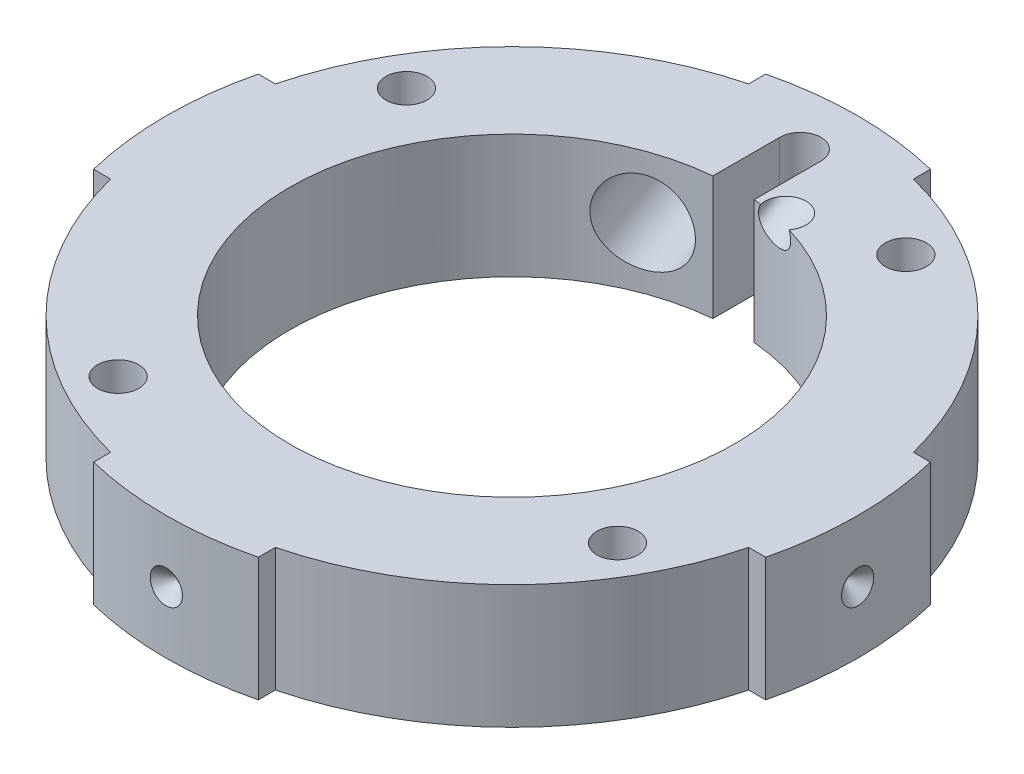
from build123d import *

# Parameters (mm, degrees)
SKETCH1_R               = 40
BOSS_EXTRUDE1_DEPTH     = 15
BOSS_EXTRUDE2_DEPTH     = 15
CIRPATTERN1_COUNT       = 4
CUT_EXTRUDE1_REACH      = 102.194
CUT_EXTRUDE1_END_RADIUS = 27
SKETCH3_R               = 5
CUT_EXTRUDE2_REACH      = 63.262
SKETCH7_R               = 2.5
CIRPATTERN2_COUNT       = 4


with BuildPart() as part:
    # Sketch1 → Boss-Extrude1 (new body)
    with BuildSketch(Plane(origin=(0, 0, 0), x_dir=(1, 0, 0), z_dir=(0, 1, 0))):
        with Locations(Location((0, 0, 0), (0, 0, 270))):
            Circle(SKETCH1_R)
        with BuildLine():
            Line((-2.5, 26.884010118), (-2.5, 35))
            ThreePointArc((-2.5, 35), (0, 37.5), (2.5, 35))
            Line((2.5, 35), (2.5, 26.884010118))
            ThreePointArc((2.5, 26.884010118), (19.956202043, 18.186533479), (27, 0))
            ThreePointArc((27, 0), (-18.186533479, -19.956202043), (-2.5, 26.884010118))
        make_face(mode=Mode.SUBTRACT)
    extrude(amount=BOSS_EXTRUDE1_DEPTH)

    # Sketch2 → Boss-Extrude2 (add)
    with BuildSketch(Plane(origin=(0, 0, 0), x_dir=(1, 0, 0), z_dir=(0, 1, 0))):
        with BuildLine():
            Line((-10, 38.729833462), (-10, 40.792156109))
            ThreePointArc((-10, 40.792156109), (0, 42), (10, 40.792156109))
            Line((10, 40.792156109), (10, 38.729833462))
            ThreePointArc((10, 38.729833462), (0, 40), (-10, 38.729833462))
        make_face()
    boss_extrude2 = extrude(amount=BOSS_EXTRUDE2_DEPTH)

    # CirPattern1: Boss-Extrude2 ×4 about axis
    cirpattern1_axis = Axis((0, 0, 0), (0, 1, 0))
    for i in range(1, CIRPATTERN1_COUNT):
        add(boss_extrude2.rotate(cirpattern1_axis, i * 360 / CIRPATTERN1_COUNT))

    # Cut-Extrude1: up to this cylinder (the profile starts outside it)
    cut_extrude1_end = Plane(origin=(0, 7.5, 0), z_dir=(0, -1, 0)) * Cylinder(CUT_EXTRUDE1_END_RADIUS, 259.388, mode=Mode.PRIVATE)
    # Sketch3 → Cut-Extrude1 (cut, up to the surface)
    with BuildSketch(Plane(origin=(-14.36484602, 0, -39.467090073), x_dir=(0, -1, 0), z_dir=(-0.34202014332566616, 0, -0.9396926207859094)), mode=Mode.PRIVATE) as cut_extrude1_sk1:
        with Locations(Location((-7.5, 0, 0), (0, 0, 90))):
            Circle(SKETCH3_R)
    cut_extrude1_tool1 = extrude(cut_extrude1_sk1.sketch, amount=-CUT_EXTRUDE1_REACH, mode=Mode.PRIVATE) - cut_extrude1_end
    add(cut_extrude1_tool1.solids().sort_by_distance((-14.364846, 7.5, -39.46709))[0], mode=Mode.SUBTRACT)

    # Cut-Loft1: read off the stored shape, not the designer's step
    # Cut-Loft1: loft between two sections, ruled curve by curve
    cut_loft1_from = [
        Edge.make_bspline([(3.514240275, 15, -26.425622361), (3.43403107, 15, -26.617896283), (3.366678926, 15, -26.845149984), (3.307378731, 15, -27.375176333), (3.316276229, 15, -27.679385236), (3.439149004, 15, -28.164052423), (3.499144635, 15, -28.33030076), (3.660731431, 15, -28.657904123), (3.762322597, 15, -28.819259148), (4.01061992, 15, -29.122797357), (4.156634299, 15, -29.264354751), (4.484735709, 15, -29.510646827), (4.666742961, 15, -29.615210684), (5.051290806, 15, -29.775629094), (5.253649364, 15, -29.831407709), (5.659510988, 15, -29.891296475), (5.862836528, 15, -29.895470114), (6.253234588, 15, -29.858370786), (6.439375692, 15, -29.817046477), (6.785871072, 15, -29.701395244), (6.946225348, 15, -29.627068321), (7.37710147, 15, -29.373403645), (7.599547955, 15, -29.165702458), (7.934492045, 15, -28.750664024), (8.048605206, 15, -28.542917202), (8.209023616, 15, -28.158369358), (8.27637576, 15, -27.931115657), (8.335675954, 15, -27.401089308), (8.326778456, 15, -27.096880405), (8.203905682, 15, -26.612213219), (8.143910051, 15, -26.445964881), (7.982323255, 15, -26.118361518), (7.880732089, 15, -25.957006493), (7.632434766, 15, -25.653468284), (7.486420387, 15, -25.51191089), (7.158318977, 15, -25.265618814), (6.976311725, 15, -25.161054957), (6.59176388, 15, -25.000636547), (6.389405322, 15, -24.944857932), (5.983543698, 15, -24.884969166), (5.780218158, 15, -24.880795527), (5.389820098, 15, -24.917894855), (5.203678994, 15, -24.959219164), (4.857183614, 15, -25.074870397), (4.696829338, 15, -25.14919732), (4.265953216, 15, -25.402861996), (4.043506731, 15, -25.610563184), (3.708562641, 15, -26.025601617), (3.59444948, 15, -26.233348439), (3.514240275, 15, -26.425622361)], [0, 0, 0, 0, 0.0625, 0.0625, 0.125, 0.125, 0.15625, 0.15625, 0.1875, 0.1875, 0.21875, 0.21875, 0.25, 0.25, 0.28125, 0.28125, 0.3125, 0.3125, 0.34375, 0.34375, 0.375, 0.375, 0.4375, 0.4375, 0.5, 0.5, 0.5625, 0.5625, 0.625, 0.625, 0.65625, 0.65625, 0.6875, 0.6875, 0.71875, 0.71875, 0.75, 0.75, 0.78125, 0.78125, 0.8125, 0.8125, 0.84375, 0.84375, 0.875, 0.875, 0.9375, 0.9375, 1, 1, 1, 1], 3),
    ]
    cut_loft1_to = [
        Edge.make_bspline([(2.074985381, 12, -24.185039409), (2.13411013, 12, -24.427947342), (2.230529651, 12, -24.695535226), (2.549951041, 12, -25.250125143), (2.77479132, 12, -25.537914734), (3.238098263, 12, -25.919158327), (3.413256539, 12, -26.037240227), (3.802322838, 12, -26.239189581), (4.016282358, 12, -26.322904324), (4.47210154, 12, -26.439875089), (4.713892566, 12, -26.472945015), (5.206175894, 12, -26.477842878), (5.456469637, 12, -26.449562366), (5.942285504, 12, -26.331312867), (6.177577655, 12, -26.241399857), (6.612541462, 12, -26.010806383), (6.812086613, 12, -25.870313491), (7.163158835, 12, -25.556942174), (7.314710473, 12, -25.384260574), (7.567442578, 12, -25.026094956), (7.668738965, 12, -24.840722901), (7.90500687, 12, -24.28920003), (7.972433417, 12, -23.93027154), (8.001244839, 12, -23.290920383), (7.963900528, 12, -23.00895336), (7.845651029, 12, -22.523137493), (7.749231508, 12, -22.255549609), (7.429810118, 12, -21.700959692), (7.204969839, 12, -21.413170101), (6.741662897, 12, -21.031926508), (6.56650462, 12, -20.913844608), (6.177438321, 12, -20.711895254), (5.963478802, 12, -20.628180512), (5.507659619, 12, -20.511209746), (5.265868593, 12, -20.47813982), (4.773585266, 12, -20.473241957), (4.523291522, 12, -20.50152247), (4.037475655, 12, -20.619771968), (3.802183505, 12, -20.709684978), (3.367219697, 12, -20.940278452), (3.167674546, 12, -21.080771344), (2.816602324, 12, -21.394142661), (2.665050687, 12, -21.566824261), (2.412318581, 12, -21.924989879), (2.311022194, 12, -22.110361934), (2.074754289, 12, -22.661884805), (2.007327743, 12, -23.020813295), (1.97851632, 12, -23.660164452), (2.015860632, 12, -23.942131475), (2.074985381, 12, -24.185039409)], [0, 0, 0, 0, 0.0625, 0.0625, 0.125, 0.125, 0.15625, 0.15625, 0.1875, 0.1875, 0.21875, 0.21875, 0.25, 0.25, 0.28125, 0.28125, 0.3125, 0.3125, 0.34375, 0.34375, 0.375, 0.375, 0.4375, 0.4375, 0.5, 0.5, 0.5625, 0.5625, 0.625, 0.625, 0.65625, 0.65625, 0.6875, 0.6875, 0.71875, 0.71875, 0.75, 0.75, 0.78125, 0.78125, 0.8125, 0.8125, 0.84375, 0.84375, 0.875, 0.875, 0.9375, 0.9375, 1, 1, 1, 1], 3),
    ]
    cut_loft1 = Solid(Shell([*[Face.make_surface_from_curves(cut_loft1_from[k], cut_loft1_to[k]) for k in range(1)], Face(Wire(cut_loft1_from)), Face(Wire(cut_loft1_to))]))
    add(cut_loft1, mode=Mode.SUBTRACT)

    # Sketch7 → Cut-Extrude2 (cut, up to next)
    with BuildSketch(Plane(origin=(0, 15, 0), x_dir=(1, 0, 0), z_dir=(0, 1, 0)), mode=Mode.PRIVATE) as cut_extrude2_sk1:
        with Locations(Location((17.5, 30.310889132, 0), (0, 0, 270))):
            Circle(SKETCH7_R)
    cut_extrude2_tool1 = extrude(cut_extrude2_sk1.sketch, amount=-CUT_EXTRUDE2_REACH, mode=Mode.PRIVATE) & part.part
    # Sketch7 → Cut-Extrude2 (cut, up to next)
    with BuildSketch(Plane(origin=(0, 15, 0), x_dir=(1, 0, 0), z_dir=(0, 1, 0)), mode=Mode.PRIVATE) as cut_extrude2_sk2:
        with Locations(Location((30.310889132, -17.5, 0), (0, 0, 270))):
            Circle(SKETCH7_R)
    cut_extrude2_tool2 = extrude(cut_extrude2_sk2.sketch, amount=-CUT_EXTRUDE2_REACH, mode=Mode.PRIVATE) & part.part
    # Sketch7 → Cut-Extrude2 (cut, up to next)
    with BuildSketch(Plane(origin=(0, 15, 0), x_dir=(1, 0, 0), z_dir=(0, 1, 0)), mode=Mode.PRIVATE) as cut_extrude2_sk3:
        with Locations(Location((-17.5, -30.310889132, 0), (0, 0, 270))):
            Circle(SKETCH7_R)
    cut_extrude2_tool3 = extrude(cut_extrude2_sk3.sketch, amount=-CUT_EXTRUDE2_REACH, mode=Mode.PRIVATE) & part.part
    # Sketch7 → Cut-Extrude2 (cut, up to next)
    with BuildSketch(Plane(origin=(0, 15, 0), x_dir=(1, 0, 0), z_dir=(0, 1, 0)), mode=Mode.PRIVATE) as cut_extrude2_sk4:
        with Locations(Location((-30.310889132, 17.5, 0), (0, 0, 270))):
            Circle(SKETCH7_R)
    cut_extrude2_tool4 = extrude(cut_extrude2_sk4.sketch, amount=-CUT_EXTRUDE2_REACH, mode=Mode.PRIVATE) & part.part
    add(cut_extrude2_tool1.solids().sort_by_distance((17.5, 15, -30.310889))[0], mode=Mode.SUBTRACT)
    add(cut_extrude2_tool2.solids().sort_by_distance((30.310889, 15, 17.5))[0], mode=Mode.SUBTRACT)
    add(cut_extrude2_tool3.solids().sort_by_distance((-17.5, 15, 30.310889))[0], mode=Mode.SUBTRACT)
    add(cut_extrude2_tool4.solids().sort_by_distance((-30.310889, 15, -17.5))[0], mode=Mode.SUBTRACT)

    # Sketch9 → Cut-Revolve4 (revolve, cut)
    with BuildSketch(Plane(origin=(0, 0, 0), x_dir=(0, 0, -1), z_dir=(1, 0, 0)), mode=Mode.PRIVATE) as cut_revolve4_sk:
        Polygon((42, 7.5), (42, 5.5), (40, 7.5), align=None)
    cut_revolve4 = revolve(cut_revolve4_sk.sketch.rotate(Axis((0, 7.5, -40), (0, 0, -1)), 180), axis=Axis((0, 7.5, -40), (0, 0, -1)), mode=Mode.SUBTRACT)

    # CirPattern2: Cut-Revolve4 ×4 about axis
    cirpattern2_axis = Axis((0, 15, 0), (0, -1, 0))
    for i in range(1, CIRPATTERN2_COUNT):
        add(cut_revolve4.rotate(cirpattern2_axis, i * 360 / CIRPATTERN2_COUNT), mode=Mode.SUBTRACT)


solid = part.part
